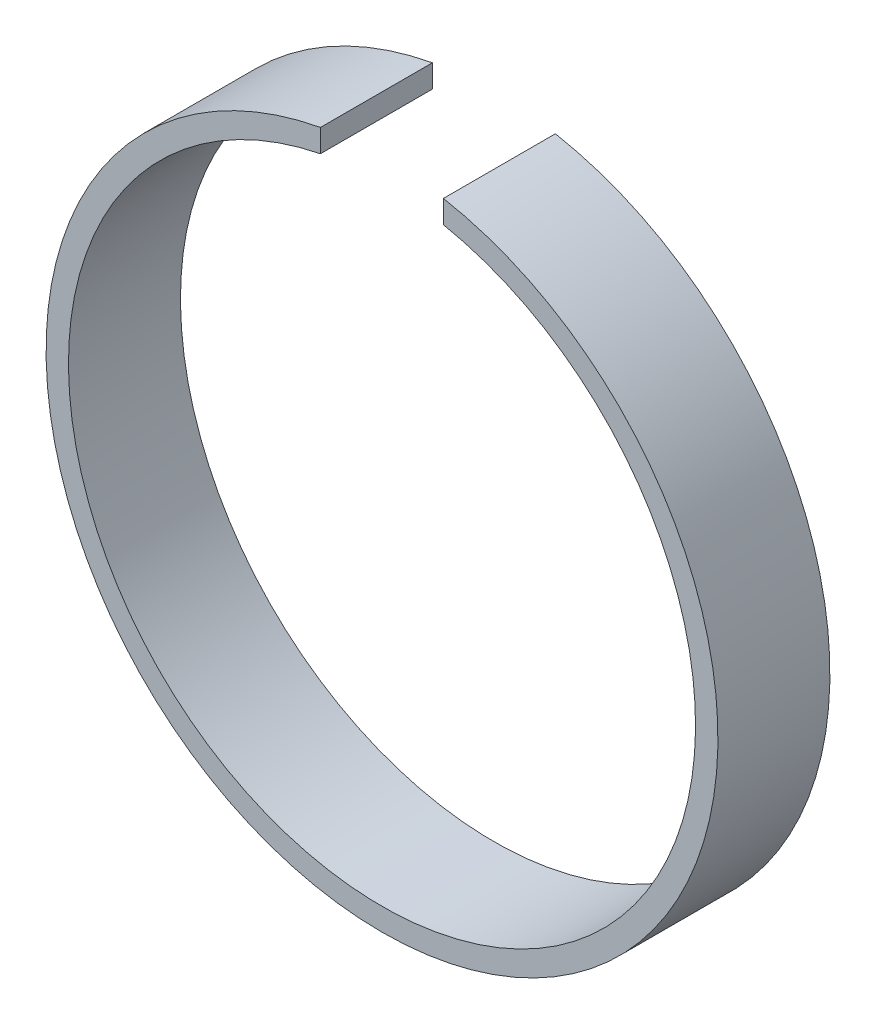
from build123d import *

# Parameters (mm, degrees)
BOSS_EXTRUDE1_DEPTH = 10


with BuildPart() as part:
    # Sketch2 → Boss-Extrude1 (new body)
    with BuildSketch(Plane.XY):
        with BuildLine():
            Line((5.483257323, 27.457856601), (5.483257323, 29.494641702))
            ThreePointArc((5.483257323, 29.494641702), (0.008515222, -29.999998792), (-5.5, 29.491524206))
            Line((-5.5, 29.491524206), (-5.5, 27.454507827))
            ThreePointArc((-5.5, 27.454507827), (0.008537147, -27.999998699), (5.483257323, 27.457856601))
        make_face()
    extrude(amount=BOSS_EXTRUDE1_DEPTH)


solid = part.part
